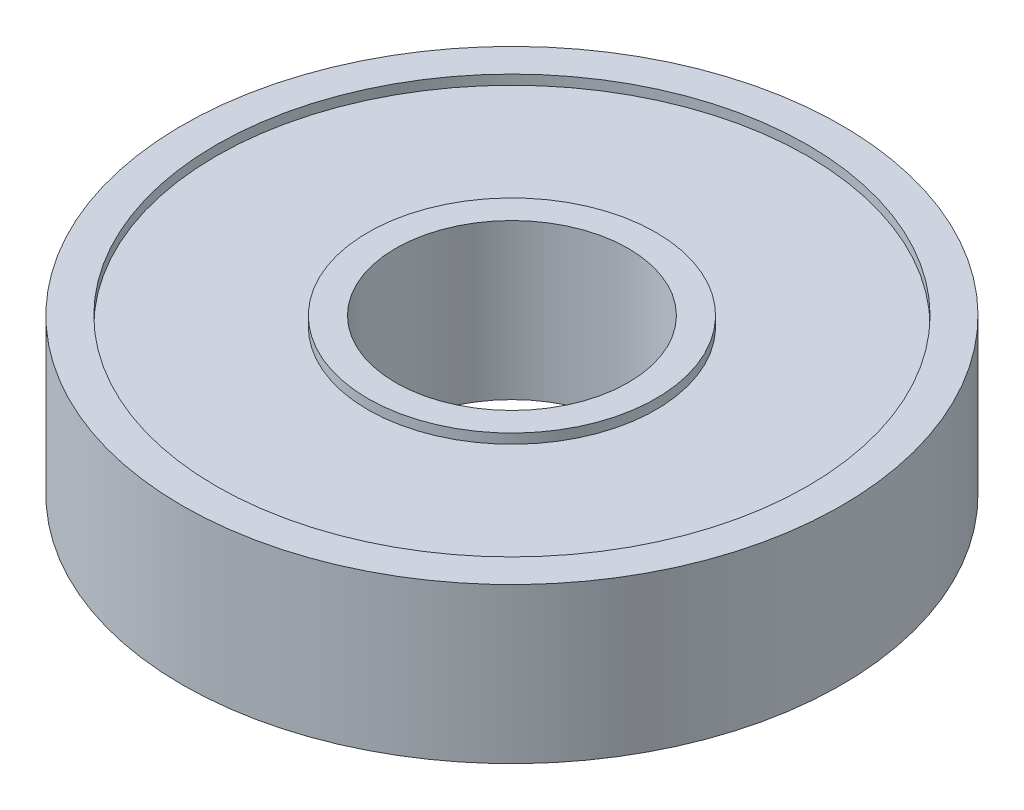
from build123d import *

# Parameters (mm, degrees)
SKETCH_1_R          = 17
SKETCH_1_R_2        = 6
EXTRUDE_1_DEPTH     = 8
SKETCH_2_R          = 15.251890777
SKETCH_2_R_2        = 7.427356703
CUT_EXTRUDE_2_DEPTH = 0.5
CUT_EXTRUDE_START   = -0.5
SKETCH_3_R          = 15.251890777
SKETCH_3_R_2        = 7.427356703
CUT_EXTRUDE_3_DEPTH = 0.5


with BuildPart() as part:
    # Эскиз1 → Вытянуть1 (new body)
    with BuildSketch(Plane(origin=(0, 0, 0), x_dir=(1, 0, 0), z_dir=(0, 1, 0))):
        Circle(SKETCH_1_R)
        Circle(SKETCH_1_R_2, mode=Mode.SUBTRACT)
    extrude(amount=EXTRUDE_1_DEPTH)

    # Эскиз2 → Вытянуть2 (cut)
    with BuildSketch(Plane(origin=(0, 8, 0), x_dir=(1, 0, 0), z_dir=(0, 1, 0))):
        Circle(SKETCH_2_R)
        Circle(SKETCH_2_R_2, mode=Mode.SUBTRACT)
    extrude(amount=-CUT_EXTRUDE_2_DEPTH, mode=Mode.SUBTRACT)

    # Эскиз3 → Вытянуть3 (cut)
    with BuildSketch(Plane.XZ.offset(CUT_EXTRUDE_START)):
        Circle(SKETCH_3_R)
        Circle(SKETCH_3_R_2, mode=Mode.SUBTRACT)
    extrude(amount=CUT_EXTRUDE_3_DEPTH, mode=Mode.SUBTRACT)


solid = part.part
